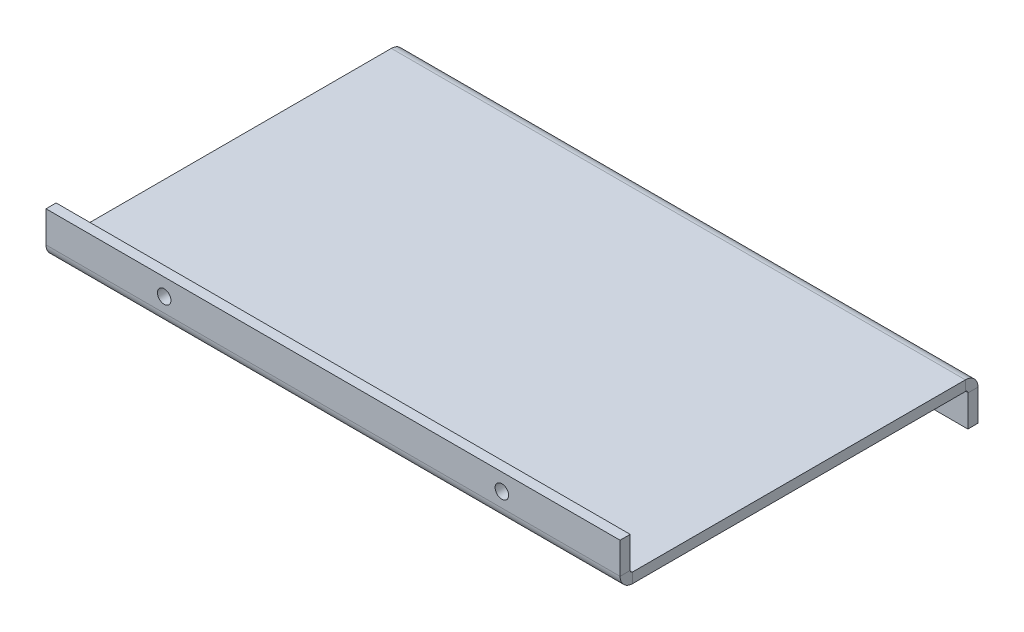
from build123d import *

# Parameters (mm, degrees)
SKETCH_1_W                       = 170
SKETCH_1_H                       = 100
SM_BASE_FLANGE_1_DEPTH           = 3
SM_EDGE_FLANGE_3_STRIP_W         = 13.4732
SM_EDGE_FLANGE_3_STRIP_H         = 3
SM_EDGE_FLANGE_3_STRIP_CUT_DEPTH = 170
SM_EDGE_FLANGE_3_DEPTH           = 170
SM_EDGE_FLANGE_4_STRIP_W         = 13.4732
SM_EDGE_FLANGE_4_STRIP_H         = 3
SM_EDGE_FLANGE_4_STRIP_CUT_DEPTH = 170
SM_EDGE_FLANGE_4_DEPTH           = 170
CUT_EXTRUDE_2_REACH              = 138.492
SKETCH_19_R                      = 2
CUT_EXTRUDE_3_REACH              = 138.492
SKETCH_20_R                      = 2


# Sheet-metal steps are written as plain solids
with BuildPart() as part:
    # Sketch 1 → 基体-法兰1 (new body)
    with BuildSketch(Plane(origin=(0, 0, 0), x_dir=(1, 0, 0), z_dir=(0, 1, 0))):
        Rectangle(SKETCH_1_W, SKETCH_1_H)
    extrude(amount=-SM_BASE_FLANGE_1_DEPTH)

    # 边线-法兰3 strip (across the edge) → 边线-法兰3 strip cut (cut)
    with BuildSketch(Plane(origin=(-85, 0, 50), x_dir=(0, 0, -1), z_dir=(1, 0, 0))):
        with Locations((-6, -1.5)):
            Rectangle(SM_EDGE_FLANGE_3_STRIP_W, SM_EDGE_FLANGE_3_STRIP_H)
    extrude(amount=SM_EDGE_FLANGE_3_STRIP_CUT_DEPTH, mode=Mode.SUBTRACT)

    # 边线-法兰3 section (across the edge) → 边线-法兰3 (add)
    with BuildSketch(Plane(origin=(-85, 0, 50), x_dir=(0, 0, -1), z_dir=(1, 0, 0))):
        with BuildLine():
            Line((-3, 0.7366), (-3, 10))
            Line((-3, 10), (0, 10))
            Line((0, 10), (0, 0.7366))
            ThreePointArc((0, 0.7366), (0.215745145, 0.215745145), (0.7366, 0))
            Line((0.7366, 0), (0.7366, -3))
            ThreePointArc((0.7366, -3), (-1.905575199, -1.905575199), (-3, 0.7366))
        make_face()
    extrude(amount=SM_EDGE_FLANGE_3_DEPTH)

    # 边线-法兰4 strip (across the edge) → 边线-法兰4 strip cut (cut)
    with BuildSketch(Plane(origin=(-85, -3, -50), x_dir=(0, 0, 1), z_dir=(1, 0, 0))):
        with Locations((-6, -1.5)):
            Rectangle(SM_EDGE_FLANGE_4_STRIP_W, SM_EDGE_FLANGE_4_STRIP_H)
    extrude(amount=SM_EDGE_FLANGE_4_STRIP_CUT_DEPTH, mode=Mode.SUBTRACT)

    # 边线-法兰4 section (across the edge) → 边线-法兰4 (add)
    with BuildSketch(Plane(origin=(-85, -3, -50), x_dir=(0, 0, 1), z_dir=(1, 0, 0))):
        with BuildLine():
            Line((-3, 0.7366), (-3, 10))
            Line((-3, 10), (0, 10))
            Line((0, 10), (0, 0.7366))
            ThreePointArc((0, 0.7366), (0.215745145, 0.215745145), (0.7366, 0))
            Line((0.7366, 0), (0.7366, -3))
            ThreePointArc((0.7366, -3), (-1.905575199, -1.905575199), (-3, 0.7366))
        make_face()
    extrude(amount=SM_EDGE_FLANGE_4_DEPTH)

    # 草图19 → 切除-拉伸2 (cut, up to next)
    with BuildSketch(Plane.XY.offset(53), mode=Mode.PRIVATE) as cut_extrude_2_sk1:
        with Locations((-50, 5)):
            Circle(SKETCH_19_R)
    cut_extrude_2_tool1 = extrude(cut_extrude_2_sk1.sketch, amount=-CUT_EXTRUDE_2_REACH, mode=Mode.PRIVATE) & part.part
    # 草图19 → 切除-拉伸2 (cut, up to next)
    with BuildSketch(Plane.XY.offset(53), mode=Mode.PRIVATE) as cut_extrude_2_sk2:
        with Locations((50, 5)):
            Circle(SKETCH_19_R)
    cut_extrude_2_tool2 = extrude(cut_extrude_2_sk2.sketch, amount=-CUT_EXTRUDE_2_REACH, mode=Mode.PRIVATE) & part.part
    add(cut_extrude_2_tool1.solids().sort_by_distance((-50, 5, 53))[0], mode=Mode.SUBTRACT)
    add(cut_extrude_2_tool2.solids().sort_by_distance((50, 5, 53))[0], mode=Mode.SUBTRACT)

    # 草图20 → 切除-拉伸3 (cut, up to next)
    with BuildSketch(Plane(origin=(0, 0, -53), x_dir=(-1, 0, 0), z_dir=(0, 0, -1)), mode=Mode.PRIVATE) as cut_extrude_3_sk1:
        with Locations(Location((-50, -8, 0), (0, 0, 90))):
            Circle(SKETCH_20_R)
    cut_extrude_3_tool1 = extrude(cut_extrude_3_sk1.sketch, amount=-CUT_EXTRUDE_3_REACH, mode=Mode.PRIVATE) & part.part
    # 草图20 → 切除-拉伸3 (cut, up to next)
    with BuildSketch(Plane(origin=(0, 0, -53), x_dir=(-1, 0, 0), z_dir=(0, 0, -1)), mode=Mode.PRIVATE) as cut_extrude_3_sk2:
        with Locations(Location((50, -8, 0), (0, 0, 90))):
            Circle(SKETCH_20_R)
    cut_extrude_3_tool2 = extrude(cut_extrude_3_sk2.sketch, amount=-CUT_EXTRUDE_3_REACH, mode=Mode.PRIVATE) & part.part
    add(cut_extrude_3_tool1.solids().sort_by_distance((50, -8, -53))[0], mode=Mode.SUBTRACT)
    add(cut_extrude_3_tool2.solids().sort_by_distance((-50, -8, -53))[0], mode=Mode.SUBTRACT)


solid = part.part
